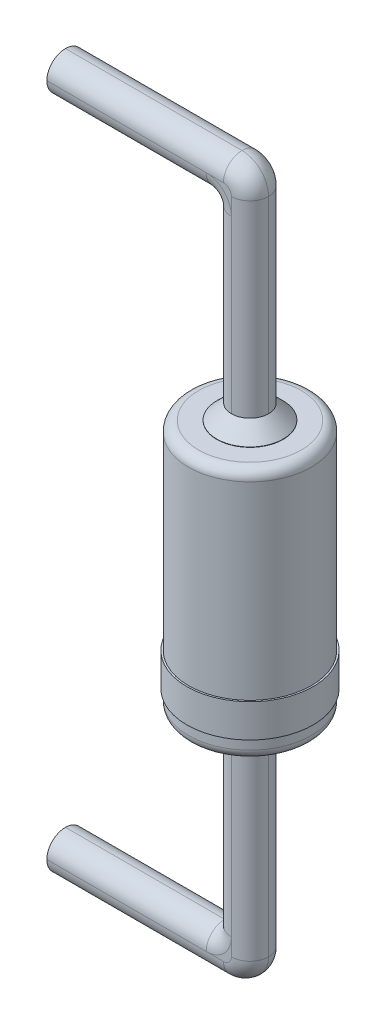
from build123d import *

# Parameters (mm, degrees)
SKETCH1_R           = 0.925
BOSS_EXTRUDE1_DEPTH = 3.8
SKETCH2_R           = 0.5
BOSS_EXTRUDE2_DEPTH = 0.225
CHAMFER2_SIZE       = 0.22
FILLET1_R           = 0.15
FILLET2_R           = 0.15
SKETCH8_W           = 0.56
SKETCH8_H           = 0.56
BOSS_EXTRUDE7_DEPTH = 3.235
SKETCH9_W           = 0.56
SKETCH9_H           = 0.56
BOSS_EXTRUDE8_DEPTH = 2.5
FILLET7_R           = 0.1
FILLET7_R_2         = 0.4
FILLET7_R_3         = 0.28
SKETCH10_R          = 0.95
SKETCH10_R_2        = 0.9
BOSS_EXTRUDE9_DEPTH = 0.5


with BuildPart() as part:
    # Sketch1 → Boss-Extrude1 (new body)
    with BuildSketch(Plane(origin=(0, 0, 0), x_dir=(1, 0, 0), z_dir=(0, 1, 0))):
        with Locations(Location((0, 0, 0), (0, 0, 90))):
            Circle(SKETCH1_R)
    extrude(amount=BOSS_EXTRUDE1_DEPTH)

    # Fillet1
    fillet1_edges = [part.edges().sort_by_distance(p)[0] for p in [
        (0, 3.8, 0.925),
    ]]
    fillet(fillet1_edges, radius=FILLET1_R)

    # Fillet2
    fillet2_edges = [part.edges().sort_by_distance(p)[0] for p in [
        (0, 0, 0.925),
    ]]
    fillet(fillet2_edges, radius=FILLET2_R)


with BuildPart() as body_2:
    # Sketch2 → Boss-Extrude2 (new body)
    with BuildSketch(Plane(origin=(0, 3.8, 0), x_dir=(1, 0, 0), z_dir=(0, 1, 0))):
        with Locations(Location((0, 0, 0), (0, 0, 270))):
            Circle(SKETCH2_R)
    extrude(amount=BOSS_EXTRUDE2_DEPTH)

    # Chamfer2
    chamfer2_edges = [body_2.edges().sort_by_distance(p)[0] for p in [
        (0, 4.025, -0.5),
    ]]
    chamfer(chamfer2_edges, length=CHAMFER2_SIZE)

    # Sketch8 → Boss-Extrude7 (add)
    with BuildSketch(Plane(origin=(0, 4.025, 0), x_dir=(1, 0, 0), z_dir=(0, 1, 0))):
        Rectangle(SKETCH8_W, SKETCH8_H)
    extrude(amount=BOSS_EXTRUDE7_DEPTH)

    # Sketch9 → Boss-Extrude8 (add)
    with BuildSketch(Plane.ZY.offset(0.28)):
        with Locations((0, 6.98)):
            Rectangle(SKETCH9_W, SKETCH9_H)
    extrude(amount=BOSS_EXTRUDE8_DEPTH)

    # Fillet7
    # the kernel refuses this fillet: 0.4, 0.28, 0.1 mm, written as the material it adds along each edge
    with BuildSketch(Plane(origin=(-0.28, 6.7, 0.28), x_dir=(-1, 0, 0), z_dir=(0, 0, -1))) as fillet7_piece_1:
        with BuildLine():
            CenterArc((FILLET7_R, -FILLET7_R), FILLET7_R, 90, 90)
            Line((0, -FILLET7_R), (0, 0))
            Line((0, 0), (FILLET7_R, 0))
        make_face()
    extrude(amount=0.56)
    # the kernel refuses this fillet: 0.4, 0.28, 0.1 mm, written as the material it takes off along each edge
    with BuildSketch(Plane(origin=(0.28, 7.26, -1.28), x_dir=(0, -1, 0), z_dir=(0, 0, 1))) as fillet7_2_piece_1:
        with BuildLine():
            CenterArc((FILLET7_R_2, -FILLET7_R_2), FILLET7_R_2, 90, 90)
            Line((0, -FILLET7_R_2), (0, 0))
            Line((0, 0), (FILLET7_R_2, 0))
        make_face()
    extrude(amount=2.56, mode=Mode.SUBTRACT)
    # the kernel refuses this fillet: 0.4, 0.28, 0.1 mm, written as the material it takes off along each edge
    with BuildSketch(Plane(origin=(0.28, 4.025, 0.28), x_dir=(0, 0, -1), z_dir=(0, 1, 0))) as fillet7_3_piece_1:
        with BuildLine():
            CenterArc((FILLET7_R_3, FILLET7_R_3), FILLET7_R_3, 180, 90)
            Line((0, FILLET7_R_3), (0, 0))
            Line((0, 0), (FILLET7_R_3, 0))
        make_face()
    extrude(amount=2.835, mode=Mode.SUBTRACT)
    with BuildSketch(Plane(origin=(0.28, 4.025, -0.28), x_dir=(0, 0, 1), z_dir=(0, 1, 0))) as fillet7_3_piece_2:
        with BuildLine():
            CenterArc((FILLET7_R_3, -FILLET7_R_3), FILLET7_R_3, 90, 90)
            Line((0, -FILLET7_R_3), (0, 0))
            Line((0, 0), (FILLET7_R_3, 0))
        make_face()
    extrude(amount=2.835, mode=Mode.SUBTRACT)
    with BuildSketch(Plane(origin=(-0.28, 4.025, 0.28), x_dir=(1, 0, 0), z_dir=(0, 1, 0))) as fillet7_3_piece_3:
        with BuildLine():
            CenterArc((FILLET7_R_3, FILLET7_R_3), FILLET7_R_3, 180, 90)
            Line((0, FILLET7_R_3), (0, 0))
            Line((0, 0), (FILLET7_R_3, 0))
        make_face()
    extrude(amount=2.575, mode=Mode.SUBTRACT)
    with BuildSketch(Plane(origin=(-0.38, 6.7, -0.28), x_dir=(0, 1, 0), z_dir=(-1, 0, 0))) as fillet7_3_piece_4:
        with BuildLine():
            CenterArc((FILLET7_R_3, -FILLET7_R_3), FILLET7_R_3, 90, 90)
            Line((0, -FILLET7_R_3), (0, 0))
            Line((0, 0), (FILLET7_R_3, 0))
        make_face()
    extrude(amount=3.1, mode=Mode.SUBTRACT)
    with BuildSketch(Plane(origin=(-0.12, 7.26, 0.28), x_dir=(0, -1, 0), z_dir=(-1, 0, 0)), Plane(origin=(-3.48, 7.26, -0.28), x_dir=(0, -1, 0), z_dir=(1, 0, 0))) as fillet7_3_piece_5:
        with BuildLine():
            CenterArc((FILLET7_R_3, -FILLET7_R_3), FILLET7_R_3, 90, 90)
            Line((0, -FILLET7_R_3), (0, 0))
            Line((0, 0), (FILLET7_R_3, 0))
        make_face()
    extrude(amount=3.36, mode=Mode.SUBTRACT)
    with BuildSketch(Plane(origin=(-0.28, 4.025, -0.28), x_dir=(1, 0, 0), z_dir=(0, 1, 0))) as fillet7_3_piece_6:
        with BuildLine():
            CenterArc((FILLET7_R_3, -FILLET7_R_3), FILLET7_R_3, 90, 90)
            Line((0, -FILLET7_R_3), (0, 0))
            Line((0, 0), (FILLET7_R_3, 0))
        make_face()
    extrude(amount=2.575, mode=Mode.SUBTRACT)
    with BuildSketch(Plane(origin=(-0.38, 6.7, 0.28), x_dir=(0, 1, 0), z_dir=(-1, 0, 0))) as fillet7_3_piece_7:
        with BuildLine():
            CenterArc((FILLET7_R_3, FILLET7_R_3), FILLET7_R_3, 180, 90)
            Line((0, FILLET7_R_3), (0, 0))
            Line((0, 0), (FILLET7_R_3, 0))
        make_face()
    extrude(amount=3.1, mode=Mode.SUBTRACT)
    with BuildSketch(Plane(origin=(-0.38, 6.6, 0.28), x_dir=(0, 1, 0), z_dir=(-1, 0, 0))) as fillet7_3_piece_8:
        with BuildLine():
            CenterArc((0.1 + FILLET7_R_3, FILLET7_R_3), FILLET7_R_3, 180, 90)
            Line((0.1, FILLET7_R_3), (0.1, 0))
            Line((0.1, 0), (0.1 + FILLET7_R_3, 0))
        make_face()
    revolve(axis=Axis((-0.38, 6.6, 0.28), (0, 0, -1)), revolution_arc=90, mode=Mode.SUBTRACT)
    with BuildSketch(Plane(origin=(-0.38, 6.6, -0.28), x_dir=(0, 1, 0), z_dir=(-1, 0, 0))) as fillet7_3_piece_9:
        with BuildLine():
            CenterArc((0.1 + FILLET7_R_3, -FILLET7_R_3), FILLET7_R_3, 90, 90)
            Line((0.1, -FILLET7_R_3), (0.1, 0))
            Line((0.1, 0), (0.1 + FILLET7_R_3, 0))
        make_face()
    revolve(axis=Axis((-0.38, 6.6, -0.28), (0, 0, -1)), revolution_arc=90, mode=Mode.SUBTRACT)
    with BuildSketch(Plane(origin=(-0.12, 6.86, -0.28), x_dir=(0, 1, 0), z_dir=(-1, 0, 0))) as fillet7_3_piece_10:
        with BuildLine():
            CenterArc((0.4 - FILLET7_R_3, -FILLET7_R_3), FILLET7_R_3, 360, 90)
            Line((0.4, -FILLET7_R_3), (0.4, 0))
            Line((0.4, 0), (0.4 - FILLET7_R_3, 0))
        make_face()
    revolve(axis=Axis((-0.12, 6.86, -0.28), (0, 0, -1)), revolution_arc=90, mode=Mode.SUBTRACT)
    with BuildSketch(Plane(origin=(-0.12, 6.86, 0.28), x_dir=(0, 1, 0), z_dir=(-1, 0, 0))) as fillet7_3_piece_11:
        with BuildLine():
            CenterArc((0.4 - FILLET7_R_3, FILLET7_R_3), FILLET7_R_3, 270, 90)
            Line((0.4, FILLET7_R_3), (0.4, 0))
            Line((0.4, 0), (0.4 - FILLET7_R_3, 0))
        make_face()
    revolve(axis=Axis((-0.12, 6.86, 0.28), (0, 0, -1)), revolution_arc=90, mode=Mode.SUBTRACT)


with BuildPart() as body_3:
    # Mirror1: mirrored copy
    add(body_2.part.mirror(Plane.ZX.offset(1.9)))


with BuildPart() as body_4:
    # Sketch10 → Boss-Extrude9 (new body)
    with BuildSketch(Plane(origin=(0, 0.8, 0), x_dir=(-1, 0, 0), z_dir=(0, 1, 0))):
        with Locations(Location((0, 0, 0), (0, 0, 90))):
            Circle(SKETCH10_R)
        with Locations(Location((0, 0, 0), (0, 0, 90))):
            Circle(SKETCH10_R_2, mode=Mode.SUBTRACT)
    extrude(amount=-BOSS_EXTRUDE9_DEPTH)


solid = Compound([part.part, body_2.part, body_3.part, body_4.part])
